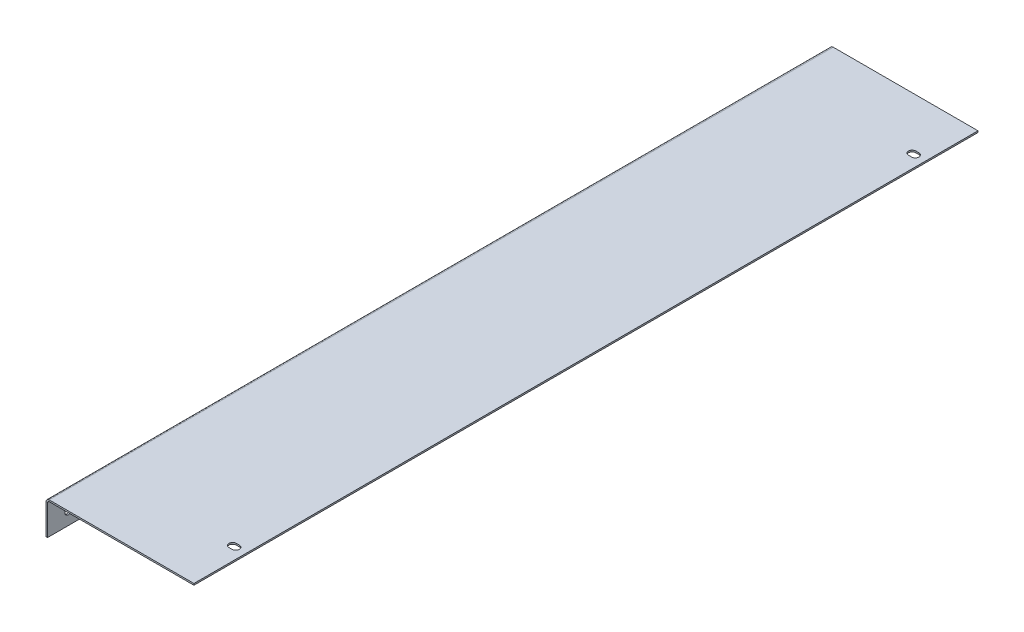
from build123d import *

# Parameters (mm, degrees)
SM_BASE_FLANGE_1_DEPTH = 375
SKETCH_7_R             = 3.5
CUT_EXTRUDE_1_DEPTH    = 10
CUT_EXTRUDE_2_DEPTH    = 10


# Sheet-metal steps are written as plain solids
with BuildPart() as part:
    # Sketch 1 → Базовая кромка1 (new, symmetric)
    with BuildSketch(Plane.XY):
        with BuildLine():
            Line((0, -32), (0, -3))
            ThreePointArc((0, -3), (0.878679656, -0.878679656), (3, 0))
            Line((3, 0), (141.5, 0))
            Line((141.5, 0), (141.5, -1.5))
            Line((141.5, -1.5), (3, -1.5))
            ThreePointArc((3, -1.5), (1.939339828, -1.939339828), (1.5, -3))
            Line((1.5, -3), (1.5, -32))
            Line((1.5, -32), (0, -32))
        make_face()
    extrude(amount=SM_BASE_FLANGE_1_DEPTH, both=True)

    # Эскиз7 → Вырез-Вытянуть1 (cut)
    with BuildSketch(Plane.ZY):
        with Locations((355, -19.5)):
            Circle(SKETCH_7_R)
    cut_extrude_1 = extrude(amount=-CUT_EXTRUDE_1_DEPTH, mode=Mode.SUBTRACT)

    # Эскиз8 → Вырез-Вытянуть2 (cut)
    with BuildSketch(Plane(origin=(0, 0, 0), x_dir=(1, 0, 0), z_dir=(0, 1, 0))):
        with BuildLine():
            Line((131.5, -328.5), (128.5, -328.5))
            ThreePointArc((128.5, -328.5), (125, -325), (128.5, -321.5))
            Line((128.5, -321.5), (131.5, -321.5))
            ThreePointArc((131.5, -321.5), (135, -325), (131.5, -328.5))
        make_face()
    cut_extrude_2 = extrude(amount=-CUT_EXTRUDE_2_DEPTH, mode=Mode.SUBTRACT)

    # Зеркальное отражение1: Вырез-Вытянуть1, Вырез-Вытянуть2 across plane
    add(cut_extrude_1.mirror(Plane.XY), mode=Mode.SUBTRACT)
    add(cut_extrude_2.mirror(Plane.XY), mode=Mode.SUBTRACT)


solid = part.part
